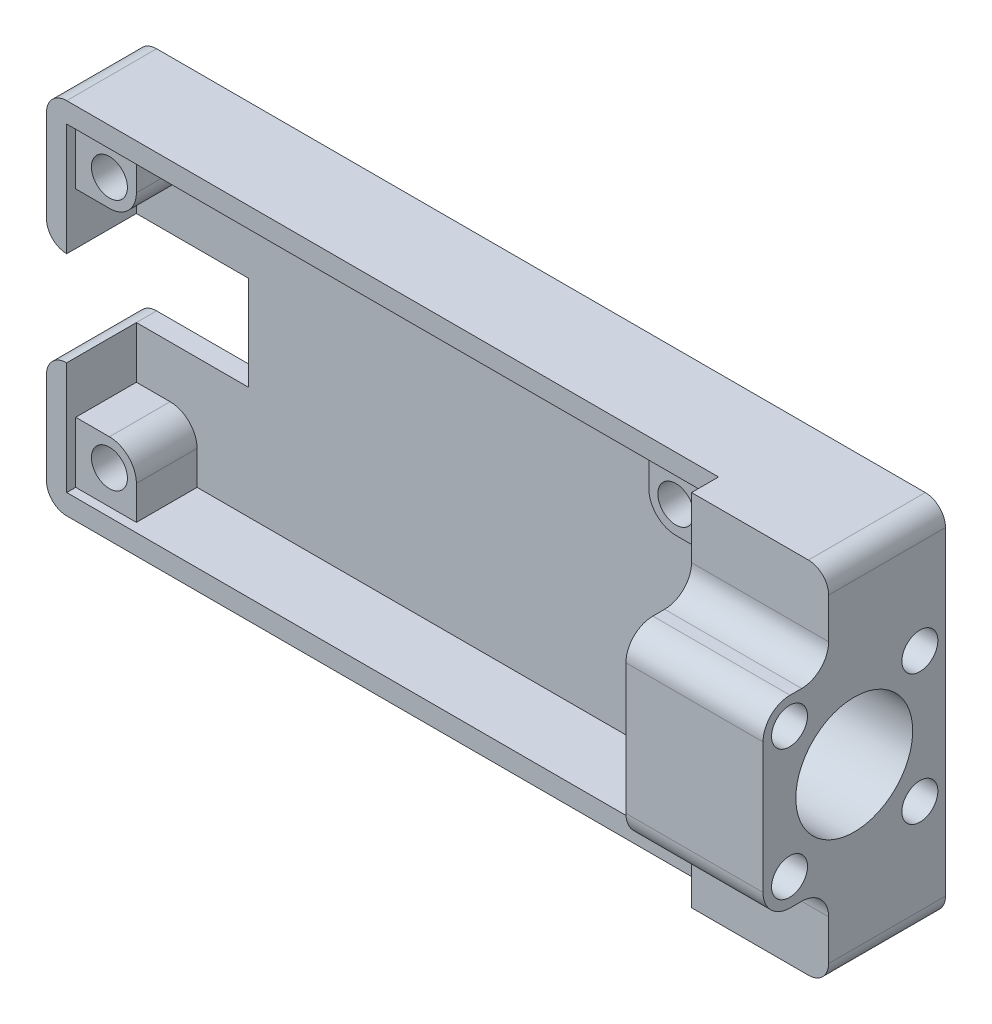
from build123d import *

# Parameters (mm, degrees)
BODY_DEPTH          = 10
PCB_RECESS_DEPTH    = 7.75
SKETCH11_R          = 3.000000000000004
SKETCH11_R_2        = 3.0000000000000084
SKETCH11_R_3        = 3.000000000000008
SKETCH11_R_4        = 2.999999999999999
PCB_BOSS_DEPTH      = 6.75
FILLET2_R           = 2.25
BOSS_EXTRUDE2_DEPTH = 15.25
SKETCH24_W          = 15.25
SKETCH24_H          = 9.74999999999999
SKETCH24_W_2        = 15.249999999999972
SKETCH24_H_2        = 9.750000000000002
BOSS_EXTRUDE3_DEPTH = 3
SKETCH25_R          = 6.5
CUT_EXTRUDE9_DEPTH  = 15
CUT_EXTRUDE10_DEPTH = 2.25
FILLET7_R           = 3
FILLET8_R           = 2.25
SKETCH27_R          = 2.0000000000000067
SKETCH27_R_2        = 2.000000000000003
SKETCH27_R_3        = 2
SKETCH27_R_4        = 1.9999999999999996
CUT_EXTRUDE11_DEPTH = 5.5
BOSS_EXTRUDE4_DEPTH = 6.75
SKETCH12_R          = 1.9999999999999991
SKETCH12_R_2        = 1.9999999999999967
SKETCH12_R_3        = 1.9999999999999996
CUT_EXTRUDE5_DEPTH  = 4.5


with BuildPart() as part:
    # Sketch4 → body (new body)
    with BuildSketch(Plane.XY):
        Polygon((0, 40), (1.73e-15, 25.25), (14.7, 25.25), (14.7, 14.750000000000002), (0, 14.75), (0, 0), (89.99999999999999, -6.94e-15), (90, 39.99999999999999), align=None)
    extrude(amount=BODY_DEPTH)

    # Sketch10 → pcb-recess (cut)
    with BuildSketch(Plane.XY.offset(10)):
        Polygon((72.75000000000001, 2.250000000000009), (2.2500000000000018, 2.2500000000000004), (2.2500000000000044, 37.74999999999999), (72.75, 37.75000000000001), align=None)
    extrude(amount=-PCB_RECESS_DEPTH, mode=Mode.SUBTRACT)

    # Sketch11 → pcb-boss (add)
    with BuildSketch(Plane.XY.offset(2.25)):
        with Locations((6.000000000000004, 34)):
            Circle(SKETCH11_R)
        with Locations((69, 34)):
            Circle(SKETCH11_R_2)
        with Locations((69, 6.000000000000005)):
            Circle(SKETCH11_R_3)
        with Locations((6.000000000000007, 6.000000000000005)):
            Circle(SKETCH11_R_4)
    extrude(amount=PCB_BOSS_DEPTH)

    # Fillet2
    fillet2_edges = [part.edges().sort_by_distance(p)[0] for p in [
        (0, 14.75, 5),
        (1.73e-15, 25.25, 5),
    ]]
    fillet(fillet2_edges, radius=FILLET2_R - 0.0001)  # a hair under: the kernel refuses the full size

    # Sketch23 → Boss-Extrude2 (add)
    with BuildSketch(Plane(origin=(89.99999999999999, -3.123e-14, 0), x_dir=(0, 0, -1), z_dir=(1, -3.5e-16, 0))):
        Polygon((-10, 30.250000000000025), (-20.299999999999997, 30.25000000000003), (-20.299999999999994, 9.750000000000027), (-9.999999999999998, 9.75000000000002), align=None)
    extrude(amount=-BOSS_EXTRUDE2_DEPTH)

    # Sketch24 → Boss-Extrude3 (add)
    with BuildSketch(Plane.XY.offset(10)):
        with Locations((82.375, 35.125)):
            Rectangle(SKETCH24_W, SKETCH24_H)
        with Locations((82.375, 4.874999999999994)):
            Rectangle(SKETCH24_W_2, SKETCH24_H_2)
    extrude(amount=BOSS_EXTRUDE3_DEPTH)

    # Sketch25 → Cut-Extrude9 (cut)
    with BuildSketch(Plane(origin=(89.99999999999999, -3.123e-14, 0), x_dir=(0, 0, -1), z_dir=(1, -3.5e-16, 0))):
        with Locations(Location((-10.149999999999999, 20.000000000000025, 0), (0, 0, 90))):
            Circle(SKETCH25_R)
    extrude(amount=-CUT_EXTRUDE9_DEPTH, mode=Mode.SUBTRACT)

    # Sketch26 → Cut-Extrude10 (cut)
    with BuildSketch(Plane(origin=(75, -2.602e-14, 0), x_dir=(0, 0, -1), z_dir=(1, -3.5e-16, 0))):
        with BuildLine():
            Line((-10.149999999999999, 26.500000000000025), (-10.149999999999999, 13.500000000000027))
            ThreePointArc((-10.149999999999999, 13.500000000000027), (-3.6499999999999986, 20.000000000000025), (-10.149999999999999, 26.500000000000025))
        make_face()
    extrude(amount=-CUT_EXTRUDE10_DEPTH, mode=Mode.SUBTRACT)

    # Fillet7
    fillet7_edges = [part.edges().sort_by_distance(p)[0] for p in [
        (82.375, 9.749999999999995, 13),
        (82.37499999999999, 9.749999999999996, 20.299999999999994),
        (82.375, 30.25, 20.299999999999997),
        (82.375, 30.25, 13),
    ]]
    fillet(fillet7_edges, radius=FILLET7_R)

    # Fillet8
    fillet8_edges = [part.edges().sort_by_distance(p)[0] for p in [
        (0, 40, 5),
        (90, 39.99999999999999, 6.5),
        (89.99999999999999, -6.94e-15, 6.5),
        (0, 0, 5),
    ]]
    fillet(fillet8_edges, radius=FILLET8_R)

    # Sketch27 → Cut-Extrude11 (cut)
    with BuildSketch(Plane(origin=(89.99999999999999, -3.123e-14, 0), x_dir=(0, 0, -1), z_dir=(1, -3.5e-16, 0))):
        with Locations(Location((-17.350000000000005, 27.300000000000026, 0), (0, 0, 90))):
            Circle(SKETCH27_R)
        with Locations(Location((-2.850000000000002, 27.300000000000026, 0), (0, 0, 90))):
            Circle(SKETCH27_R_2)
        with Locations(Location((-2.8499999999999948, 12.800000000000026, 0), (0, 0, 90))):
            Circle(SKETCH27_R_3)
        with Locations(Location((-17.349999999999998, 12.800000000000026, 0), (0, 0, 90))):
            Circle(SKETCH27_R_4)
    extrude(amount=-CUT_EXTRUDE11_DEPTH, mode=Mode.SUBTRACT)

    # Sketch28 → Boss-Extrude4 (add)
    with BuildSketch(Plane.XY.offset(2.25)):
        with BuildLine():
            Line((6.000000000000004, 31), (2.2500000000000036, 31))
            Line((2.2500000000000036, 31), (2.2500000000000044, 37.74999999999999))
            Line((2.2500000000000044, 37.74999999999999), (9.000000000000007, 37.74999999999999))
            Line((9.000000000000007, 37.74999999999999), (9.000000000000007, 34))
            ThreePointArc((9.000000000000007, 34), (8.121320343559649, 31.878679656440355), (6.000000000000004, 31))
        make_face()
        with BuildLine():
            Line((65.99999999999999, 37.75000000000001), (65.99999999999999, 34.000000000000014))
            ThreePointArc((65.99999999999999, 34.000000000000014), (66.87867965644034, 31.878679656440372), (68.99999999999999, 31.000000000000014))
            Line((68.99999999999999, 31.000000000000014), (72.75, 31.000000000000014))
            Line((72.75, 31.000000000000014), (72.75, 37.75000000000001))
            Line((72.75, 37.75000000000001), (65.99999999999999, 37.75000000000001))
        make_face()
        with BuildLine():
            Line((68.99999999999999, 8.999999999999988), (72.75, 8.999999999999988))
            Line((72.75, 8.999999999999988), (72.75, 2.249999999999995))
            Line((72.75, 2.249999999999995), (65.99999999999999, 2.249999999999995))
            Line((65.99999999999999, 2.249999999999995), (65.99999999999999, 5.999999999999985))
            ThreePointArc((65.99999999999999, 5.999999999999985), (66.87867965644034, 8.121320343559628), (68.99999999999999, 8.999999999999988))
        make_face()
        with BuildLine():
            Line((9.000000000000007, 2.250000000000009), (9.000000000000007, 5.999999999999998))
            ThreePointArc((9.000000000000007, 5.999999999999998), (8.121320343559649, 8.121320343559642), (6.000000000000004, 9.000000000000002))
            Line((6.000000000000004, 9.000000000000002), (2.2500000000000036, 9.000000000000002))
            Line((2.2500000000000036, 9.000000000000002), (2.2500000000000044, 2.250000000000009))
            Line((2.2500000000000044, 2.250000000000009), (9.000000000000007, 2.250000000000009))
        make_face()
    extrude(amount=BOSS_EXTRUDE4_DEPTH)

    # Sketch12 → Cut-Extrude5 (cut)
    with BuildSketch(Plane.XY.offset(9.000000000000002)):
        with Locations((6.000000000000004, 34)):
            Circle(SKETCH12_R)
        with Locations((69, 34)):
            Circle(SKETCH12_R_2)
        with Locations((69, 6.000000000000005)):
            Circle(SKETCH12_R_2)
        with Locations((6.000000000000007, 6.000000000000005)):
            Circle(SKETCH12_R_3)
    extrude(amount=-CUT_EXTRUDE5_DEPTH, mode=Mode.SUBTRACT)


solid = part.part
